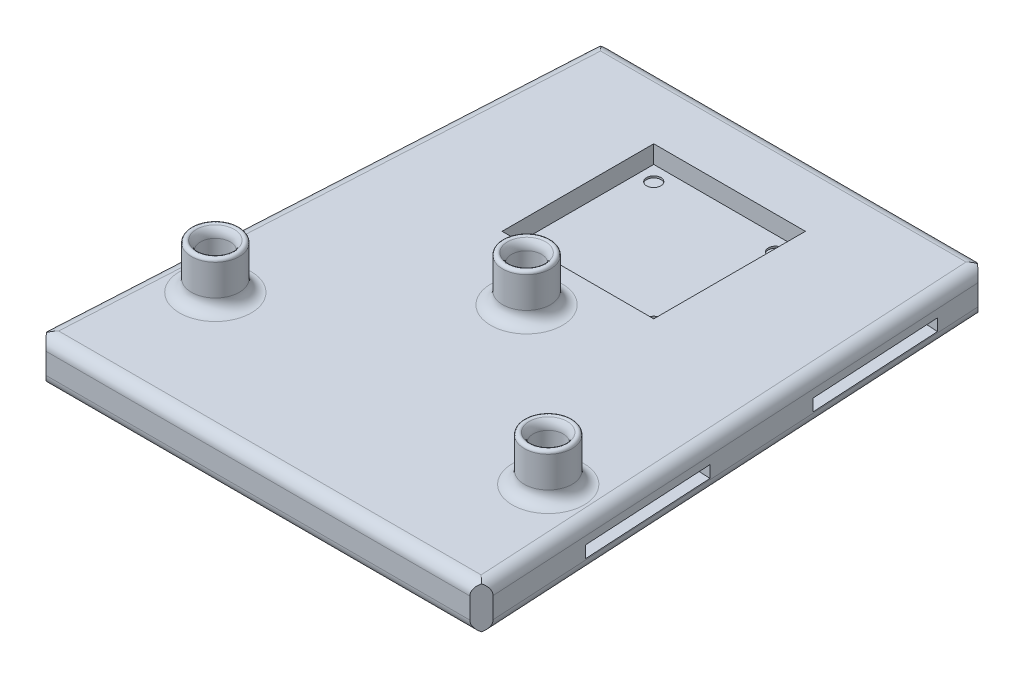
from build123d import *

# Parameters (mm, degrees)
BOSS_EXTRUDE2_DEPTH     = 7.5
SKETCH6_W               = 25.4
SKETCH6_H               = 25.4
CUT_EXTRUDE2_DEPTH      = 3
SKETCH8_R               = 1.2
SKETCH8_R_2             = 1.25
CUT_EXTRUDE3_DEPTH      = 59.678716795
SKETCH9_R               = 4
BOSS_EXTRUDE5_DEPTH     = 8
CUT_EXTRUDE4_DEPTH      = 88.567489866
CUT_EXTRUDE4_DEPTH_BACK = 88.567489866
SKETCH11_W              = 22
SKETCH11_H              = 2
CUT_EXTRUDE5_DEPTH      = 61.524307553
CUT_EXTRUDE5_DEPTH_BACK = 61.524307553
SKETCH12_R              = 1
CUT_EXTRUDE6_DEPTH      = 61.524307553
CUT_EXTRUDE6_DEPTH_BACK = 5
SKETCH13_R              = 2.5
FILLET1_R               = 2
FILLET2_R               = 2
FILLET3_R               = 0.5
FILLET4_R               = 2


with BuildPart() as part:
    # Sketch2 → Boss-Extrude2 (new body)
    with BuildSketch(Plane(origin=(0, 0, 0), x_dir=(1, 0, 0), z_dir=(0, 1, 0))):
        Polygon((-35.5, -45), (35.5, -45), (37.389059961, -43.003079294), (32.610940039, 43.003079294), (30.5, 45), (-30.5, 45), (-32.610940039, 43.003079294), (-37.389059961, -43.003079294), align=None)
    extrude(amount=BOSS_EXTRUDE2_DEPTH)

    # Sketch6 → Cut-Extrude2 (cut)
    with BuildSketch(Plane(origin=(0, 7.5, 0), x_dir=(1, 0, 0), z_dir=(0, 1, 0))):
        with Locations((0, 21.3)):
            Rectangle(SKETCH6_W, SKETCH6_H)
    extrude(amount=-CUT_EXTRUDE2_DEPTH, mode=Mode.SUBTRACT)

    # Sketch8 → Cut-Extrude3 (cut, through all)
    with BuildSketch(Plane(origin=(0, 4.5, 0), x_dir=(1, 0, 0), z_dir=(0, 1, 0))):
        with Locations(Location((-10.2, 31.5, 0), (0, 0, 270))):
            Circle(SKETCH8_R)
        with Locations(Location((-10.2, 11.1, 0), (0, 0, 270))):
            Circle(SKETCH8_R_2)
        with Locations(Location((10.2, 11.1, 0), (0, 0, 90))):
            Circle(SKETCH8_R_2)
        with Locations(Location((10.2, 31.5, 0), (0, 0, 90))):
            Circle(SKETCH8_R)
    extrude(amount=-CUT_EXTRUDE3_DEPTH, mode=Mode.SUBTRACT)

    # Sketch9 → Boss-Extrude5 (add)
    with BuildSketch(Plane(origin=(0, 7.5, 0), x_dir=(1, 0, 0), z_dir=(0, 1, 0))):
        with Locations(Location((-27.865142546, -24.267662345, 0), (0, 0, 90))):
            Circle(SKETCH9_R)
        with Locations(Location((27.866029503, -24.242557469, 0), (0, 0, 90))):
            Circle(SKETCH9_R)
        with Locations(Location((0, 0, 0), (0, 0, 90))):
            Circle(SKETCH9_R)
    extrude(amount=BOSS_EXTRUDE5_DEPTH)

    # Sketch11 → Cut-Extrude4 (cut, two sides: drawn at the far end of the back side and taken through both)
    with BuildSketch(Plane(origin=(-34.892307692, 0, -1.938461538), x_dir=(-0.05547001962252269, 0, 0.9984603532054125), z_dir=(-0.9984603532054126, 0, -0.055470019622522695)).offset(-CUT_EXTRUDE4_DEPTH_BACK)):
        with Locations((-26.597148694, 3.2)):
            Rectangle(SKETCH11_W, SKETCH11_H)
        with Locations((13.580529235, 3.2)):
            Rectangle(SKETCH11_W, SKETCH11_H)
    extrude(amount=CUT_EXTRUDE4_DEPTH + CUT_EXTRUDE4_DEPTH_BACK, mode=Mode.SUBTRACT)

    # Sketch12 → Cut-Extrude5 (cut, two sides: drawn at the far end of the back side and taken through both)
    with BuildSketch(Plane(origin=(0, 15.5, 0), x_dir=(1, 0, 0), z_dir=(0, 1, 0)).offset(-CUT_EXTRUDE5_DEPTH_BACK)):
        with Locations(Location((-27.865142546, -24.267662345, 0), (0, 0, 270))):
            Circle(SKETCH12_R)
        with Locations(Location((0, 0, 0), (0, 0, 270))):
            Circle(SKETCH12_R)
        with Locations(Location((27.866029503, -24.242557469, 0), (0, 0, 270))):
            Circle(SKETCH12_R)
    extrude(amount=CUT_EXTRUDE5_DEPTH + CUT_EXTRUDE5_DEPTH_BACK, mode=Mode.SUBTRACT)

    # Sketch13 → Cut-Extrude6 (cut, two sides: drawn at the far end of the back side and taken through both)
    with BuildSketch(Plane(origin=(0, 15.5, 0), x_dir=(1, 0, 0), z_dir=(0, 1, 0)).offset(-CUT_EXTRUDE6_DEPTH_BACK)):
        with Locations(Location((-27.865142546, -24.267662345, 0), (0, 0, 90))):
            Circle(SKETCH13_R)
        with Locations(Location((0, 0, 0), (0, 0, 90))):
            Circle(SKETCH13_R)
        with Locations(Location((27.866029503, -24.242557469, 0), (0, 0, 90))):
            Circle(SKETCH13_R)
    extrude(amount=CUT_EXTRUDE6_DEPTH + CUT_EXTRUDE6_DEPTH_BACK, mode=Mode.SUBTRACT)

    # Fillet1
    # the kernel refuses this fillet: 2 mm, written as the material it takes off along each edge
    with BuildSketch(Plane(origin=(35.5, 0, -45), x_dir=(0, 0, 1), z_dir=(-1, 0, 0))) as fillet1_piece_1:
        with BuildLine():
            CenterArc((FILLET1_R, FILLET1_R), FILLET1_R, 180, 90)
            Line((0, FILLET1_R), (0, 0))
            Line((0, 0), (FILLET1_R, 0))
        make_face()
    extrude(amount=71, mode=Mode.SUBTRACT)
    with BuildSketch(Plane(origin=(35.5, 7.5, -45), x_dir=(0, 0, 1), z_dir=(-1, 0, 0))) as fillet1_piece_2:
        with BuildLine():
            CenterArc((FILLET1_R, -FILLET1_R), FILLET1_R, 90, 90)
            Line((0, -FILLET1_R), (0, 0))
            Line((0, 0), (FILLET1_R, 0))
        make_face()
    extrude(amount=71, mode=Mode.SUBTRACT)
    with BuildSketch(Plane(origin=(37.666410059, 0, 47.99538106), x_dir=(-0.9984603532054125, 0, 0.055470019622522966), z_dir=(-0.05547001962252297, 0, -0.9984603532054125)), Plane(origin=(-32.333589941, 0, -47.99538106), x_dir=(0.9984603532054126, 0, 0.055470019622522654), z_dir=(-0.05547001962252265, 0, 0.9984603532054125))) as fillet1_piece_3:
        with BuildLine():
            CenterArc((FILLET1_R, FILLET1_R), FILLET1_R, 180, 90)
            Line((0, FILLET1_R), (0, 0))
            Line((0, 0), (FILLET1_R, 0))
        make_face()
    extrude(amount=96.138781887, mode=Mode.SUBTRACT)
    with BuildSketch(Plane(origin=(37.666410059, 7.5, 47.99538106), x_dir=(-0.9984603532054125, 0, 0.055470019622522966), z_dir=(-0.05547001962252297, 0, -0.9984603532054125)), Plane(origin=(-32.333589941, 7.5, -47.99538106), x_dir=(0.9984603532054126, 0, 0.055470019622522654), z_dir=(-0.05547001962252265, 0, 0.9984603532054125))) as fillet1_piece_4:
        with BuildLine():
            CenterArc((FILLET1_R, -FILLET1_R), FILLET1_R, 90, 90)
            Line((0, -FILLET1_R), (0, 0))
            Line((0, 0), (FILLET1_R, 0))
        make_face()
    extrude(amount=96.138781887, mode=Mode.SUBTRACT)
    with BuildSketch(Plane(origin=(-40.5, 7.5, 45), x_dir=(0, -1, 0), z_dir=(1, 0, 0))) as fillet1_piece_5:
        with BuildLine():
            CenterArc((FILLET1_R, FILLET1_R), FILLET1_R, 180, 90)
            Line((0, FILLET1_R), (0, 0))
            Line((0, 0), (FILLET1_R, 0))
        make_face()
    extrude(amount=81, mode=Mode.SUBTRACT)
    with BuildSketch(Plane(origin=(-40.5, 0, 45), x_dir=(0, 1, 0), z_dir=(1, 0, 0))) as fillet1_piece_6:
        with BuildLine():
            CenterArc((FILLET1_R, -FILLET1_R), FILLET1_R, 90, 90)
            Line((0, -FILLET1_R), (0, 0))
            Line((0, 0), (FILLET1_R, 0))
        make_face()
    extrude(amount=81, mode=Mode.SUBTRACT)

    # Fillet2
    # the kernel refuses this fillet: 2 mm, written as the material it takes off along each edge
    with BuildSketch(Plane(origin=(-27.865142546, 15.5, 24.267662345), x_dir=(0, 0, -1), z_dir=(1, 0, 0))) as fillet2_piece_1:
        with BuildLine():
            CenterArc((4.5, -1.936491673), FILLET2_R, 104.477512186, 75.522487814)
            Line((2.5, -1.936491673), (2.46, -1.936491673))
            Line((2.46, -1.936491673), (2.46, 0))
            Line((2.46, 0), (2.5, 0.04))
            ThreePointArc((2.5, 0.04), (3.25, 0.04), (3.99, 0.038729833))
            Line((3.99, 0.038729833), (4, 0))
        make_face()
    revolve(axis=Axis((-27.865142546, 15.5, 24.267662345), (0, 1, 0)), mode=Mode.SUBTRACT)
    with BuildSketch(Plane(origin=(0, 15.5, 0), x_dir=(0, 0, -1), z_dir=(1, 0, 0))) as fillet2_piece_2:
        with BuildLine():
            CenterArc((4.5, -1.936491673), FILLET2_R, 104.477512186, 75.522487814)
            Line((2.5, -1.936491673), (2.46, -1.936491673))
            Line((2.46, -1.936491673), (2.46, 0))
            Line((2.46, 0), (2.5, 0.04))
            ThreePointArc((2.5, 0.04), (3.25, 0.04), (3.99, 0.038729833))
            Line((3.99, 0.038729833), (4, 0))
        make_face()
    revolve(axis=Axis((0, 15.5, 0), (0, 1, 0)), mode=Mode.SUBTRACT)
    with BuildSketch(Plane(origin=(27.866029503, 15.5, 24.242557469), x_dir=(0, 0, -1), z_dir=(1, 0, 0))) as fillet2_piece_3:
        with BuildLine():
            CenterArc((4.5, -1.936491673), FILLET2_R, 104.477512186, 75.522487814)
            Line((2.5, -1.936491673), (2.46, -1.936491673))
            Line((2.46, -1.936491673), (2.46, 0))
            Line((2.46, 0), (2.5, 0.04))
            ThreePointArc((2.5, 0.04), (3.25, 0.04), (3.99, 0.038729833))
            Line((3.99, 0.038729833), (4, 0))
        make_face()
    revolve(axis=Axis((27.866029503, 15.5, 24.242557469), (0, 1, 0)), mode=Mode.SUBTRACT)

    # Fillet3
    fillet3_edges = [part.edges().sort_by_distance(p)[0] for p in [
        (-27.865142546, 15.5, 28.267662345),
        (27.866029503, 15.5, 28.242557469),
        (0, 15.5, 4),
    ]]
    fillet(fillet3_edges, radius=FILLET3_R)

    # Fillet4
    fillet4_edges = [part.edges().sort_by_distance(p)[0] for p in [
        (-27.865142546, 7.5, 28.267662345),
        (27.866029503, 7.5, 28.242557469),
        (0, 7.5, 4),
    ]]
    fillet(fillet4_edges, radius=FILLET4_R)


solid = part.part
